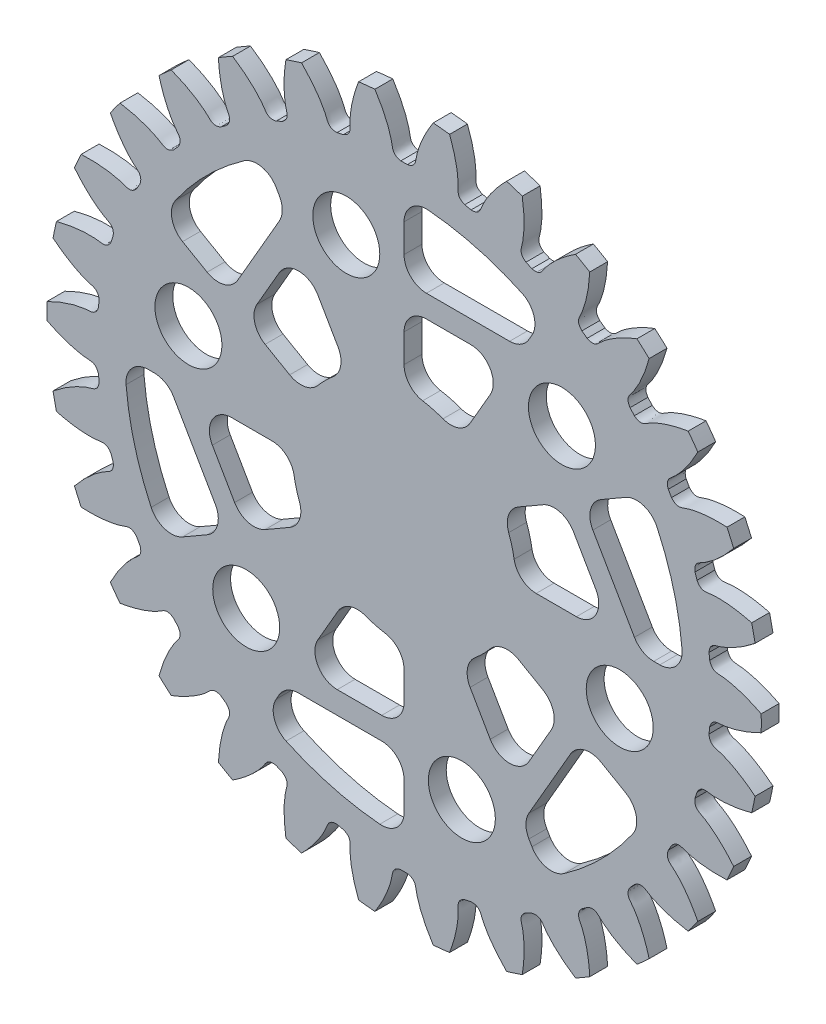
from build123d import *

# Parameters (mm, degrees)
SKETCH_1_R               = 16
EXTRUDE_1_DEPTH          = 30
CUT_EXTRUDE_1_DEPTH      = 38.576588456
PATTERN_CIRCULAR_1_COUNT = 30
SKETCH_4_R               = 28.122827659
CUT_EXTRUDE_2_DEPTH      = 29.2
SKETCH_5_R               = 2.9
EXTRUDE_2_DEPTH          = 1.3
SKETCH_8_R               = 1.4
EXTRUDE_4_DEPTH          = 0.7
SKETCH_9_R               = 1.5
CUT_EXTRUDE_5_DEPTH      = 10
EXTRUDE_5_DEPTH          = 0.8
FILLET_1_R               = 1


with BuildPart() as part:
    # 草图1 → 凸台-拉伸1 (new body)
    with BuildSketch(Plane.XY):
        Circle(SKETCH_1_R)
    extrude(amount=EXTRUDE_1_DEPTH)

    # 草图2 → 切除-拉伸1 (cut, through all)
    with BuildSketch(Plane.XY):
        with BuildLine():
            ThreePointArc((0.145558629, 13.749229531), (0, 13.75), (-0.145558629, 13.749229531))
            add(Edge.make_bspline(
                [(-0.145558629, 13.749229531), (-0.50823069, 13.81297517), (-0.510304747, 14.047132636), (-0.55898482, 14.288579015), (-0.569950741, 14.338129238), (-0.583247086, 14.392924909), (-0.599067717, 14.452897992), (-0.617630624, 14.517964907), (-0.639143358, 14.588038514), (-0.663813512, 14.663024477), (-0.691845294, 14.742822461), (-0.723440342, 14.827325855), (-0.758797267, 14.91642195), (-0.798111576, 15.009991983), (-0.841575482, 15.107911227), (-0.889377751, 15.210049075), (-0.941703547, 15.316269128), (-0.99873427, 15.426429286), (-1.060647407, 15.54038185), (-1.127616379, 15.657973616), (-1.199810393, 15.779045984), (-1.277394296, 15.903435064), (-1.36052843, 16.030971789), (-1.449368495, 16.161482028), (-1.544065407, 16.294786707), (-1.644765164, 16.430701934), (-1.751608718, 16.569039116), (-1.864731839, 16.709605098), (-1.984264996, 16.85220229), (-2.110333232, 16.996628804), (-2.243056043, 17.14267859), (-2.382547265, 17.290141584), (-2.528914958, 17.438803847), (-2.682261311, 17.588447714), (-2.842682483, 17.738851945), (-3.068923866, 17.942620828), (-3.245344618, 18.092071531), (-3.366311832, 18.190558123)],
                knots=[0, 0, 0, 0, 0.115323882, 0.12341257, 0.132512303, 0.142623081, 0.153744905, 0.165877774, 0.179021689, 0.193176649, 0.208342655, 0.224519706, 0.241707802, 0.259906945, 0.279117132, 0.299338365, 0.320570644, 0.342813968, 0.366068337, 0.390333752, 0.415610213, 0.441897719, 0.46919627, 0.497505867, 0.52682651, 0.557158198, 0.588500931, 0.62085471, 0.654219534, 0.688595404, 0.723982319, 0.76038028, 0.797789286, 0.836209338, 0.875640435, 0.916082578, 1, 1, 1, 1], degree=3))
            ThreePointArc((-3.366311832, 18.190558123), (0, 18.499417833), (3.366311832, 18.190558123))
            add(Edge.make_bspline(
                [(0.145558629, 13.749229531), (0.50823069, 13.81297517), (0.510304747, 14.047132636), (0.55898482, 14.288579015), (0.569950741, 14.338129238), (0.583247086, 14.392924909), (0.599067717, 14.452897992), (0.617630624, 14.517964907), (0.639143358, 14.588038514), (0.663813512, 14.663024477), (0.691845294, 14.742822461), (0.723440342, 14.827325855), (0.758797267, 14.91642195), (0.798111576, 15.009991983), (0.841575482, 15.107911227), (0.889377751, 15.210049075), (0.941703547, 15.316269128), (0.99873427, 15.426429286), (1.060647407, 15.54038185), (1.127616379, 15.657973616), (1.199810393, 15.779045984), (1.277394296, 15.903435064), (1.36052843, 16.030971789), (1.449368495, 16.161482028), (1.544065407, 16.294786707), (1.644765164, 16.430701934), (1.751608718, 16.569039116), (1.864731839, 16.709605098), (1.984264996, 16.85220229), (2.110333232, 16.996628804), (2.243056043, 17.14267859), (2.382547265, 17.290141584), (2.528914958, 17.438803847), (2.682261311, 17.588447714), (2.842682483, 17.738851945), (3.068923866, 17.942620828), (3.245344618, 18.092071531), (3.366311832, 18.190558123)],
                knots=[0, 0, 0, 0, 0.115323882, 0.12341257, 0.132512303, 0.142623081, 0.153744905, 0.165877774, 0.179021689, 0.193176649, 0.208342655, 0.224519706, 0.241707802, 0.259906945, 0.279117132, 0.299338365, 0.320570644, 0.342813968, 0.366068337, 0.390333752, 0.415610213, 0.441897719, 0.46919627, 0.497505867, 0.52682651, 0.557158198, 0.588500931, 0.62085471, 0.654219534, 0.688595404, 0.723982319, 0.76038028, 0.797789286, 0.836209338, 0.875640435, 0.916082578, 1, 1, 1, 1], degree=3))
        make_face()
    cut_extrude_1 = extrude(amount=CUT_EXTRUDE_1_DEPTH, mode=Mode.SUBTRACT)

    # 阵列(圆周)1: 切除-拉伸1 ×30 about axis
    pattern_circular_1_axis = Axis((0, 0, -1.5), (0, 0, 1))
    for i in range(1, PATTERN_CIRCULAR_1_COUNT):
        add(cut_extrude_1.rotate(pattern_circular_1_axis, i * 360 / PATTERN_CIRCULAR_1_COUNT), mode=Mode.SUBTRACT)

    # 草图4 → 切除-拉伸2 (cut)
    with BuildSketch(Plane.XY.offset(30)):
        Circle(SKETCH_4_R)
    extrude(amount=-CUT_EXTRUDE_2_DEPTH, mode=Mode.SUBTRACT)

    # 草图5 → 凸台-拉伸2 (add)
    with BuildSketch(Plane.XY):
        Circle(SKETCH_5_R)
    extrude(amount=-EXTRUDE_2_DEPTH)

    # 草图8 → 凸台-拉伸4 (add)
    with BuildSketch(Plane(origin=(0, 0, -1.3), x_dir=(-1, 0, 0), z_dir=(0, 0, -1))):
        Circle(SKETCH_8_R)
    extrude(amount=EXTRUDE_4_DEPTH)

    # 草图9 → 切除-拉伸5 (cut)
    with BuildSketch(Plane(origin=(0, 0, 0), x_dir=(-1, 0, 0), z_dir=(0, 0, -1))):
        with BuildLine():
            ThreePointArc((-2.5, 4.330127019), (-1.294095226, 4.829629131), (0, 5))
            Line((0, 5), (0, 12.5))
            ThreePointArc((0, 12.5), (-3.235238064, 12.074072829), (-6.25, 10.825317547))
            Line((-6.25, 10.825317547), (-2.5, 4.330127019))
        make_face()
        with BuildLine():
            Line((6.25, 10.825317547), (2.5, 4.330127019))
            ThreePointArc((2.5, 4.330127019), (3.535533906, 3.535533906), (4.330127019, 2.5))
            Line((4.330127019, 2.5), (10.825317547, 6.25))
            ThreePointArc((10.825317547, 6.25), (8.838834765, 8.838834765), (6.25, 10.825317547))
        make_face()
        with BuildLine():
            Line((12.5, 0), (5, 0))
            ThreePointArc((5, 0), (4.829629131, -1.294095226), (4.330127019, -2.5))
            Line((4.330127019, -2.5), (10.825317547, -6.25))
            ThreePointArc((10.825317547, -6.25), (12.074072829, -3.235238064), (12.5, 0))
        make_face()
        with BuildLine():
            Line((6.25, -10.825317547), (2.5, -4.330127019))
            ThreePointArc((2.5, -4.330127019), (1.294095226, -4.829629131), (0, -5))
            Line((0, -5), (0, -12.5))
            ThreePointArc((0, -12.5), (3.235238064, -12.074072829), (6.25, -10.825317547))
        make_face()
        with BuildLine():
            Line((-6.25, -10.825317547), (-2.5, -4.330127019))
            ThreePointArc((-2.5, -4.330127019), (-3.535533906, -3.535533906), (-4.330127019, -2.5))
            Line((-4.330127019, -2.5), (-10.825317547, -6.25))
            ThreePointArc((-10.825317547, -6.25), (-8.838834765, -8.838834765), (-6.25, -10.825317547))
        make_face()
        with BuildLine():
            Line((-12.5, 0), (-5, 0))
            ThreePointArc((-5, 0), (-4.829629131, 1.294095226), (-4.330127019, 2.5))
            Line((-4.330127019, 2.5), (-10.825317547, 6.25))
            ThreePointArc((-10.825317547, 6.25), (-12.074072829, 3.235238064), (-12.5, 0))
        make_face()
        with Locations((2.588190451, 9.659258263)):
            Circle(SKETCH_9_R)
        with Locations((9.659258263, 2.588190451)):
            Circle(SKETCH_9_R)
        with Locations((7.071067812, -7.071067812)):
            Circle(SKETCH_9_R)
        with Locations((-2.588190451, -9.659258263)):
            Circle(SKETCH_9_R)
        with Locations((-9.659258263, -2.588190451)):
            Circle(SKETCH_9_R)
        with Locations((-7.071067812, 7.071067812)):
            Circle(SKETCH_9_R)
    extrude(amount=-CUT_EXTRUDE_5_DEPTH, mode=Mode.SUBTRACT)

    # 草图10 → 凸台-拉伸5 (add)
    with BuildSketch(Plane(origin=(0, 0, 0), x_dir=(-1, 0, 0), z_dir=(0, 0, -1))):
        Polygon((0, 9.18625951), (0, 8.18625951), (-4.726339132, 8.18625951), (-5.303689401, 9.18625951), align=None)
        Polygon((-7.955534102, 4.593129755), (-10.607378802, 0), (-9.452678264, 0), (-7.089508698, 4.093129755), align=None)
        Polygon((7.955534102, 4.593129755), (7.089508698, 4.093129755), (4.726339132, 8.18625951), (5.303689401, 9.18625951), align=None)
        Polygon((7.955534102, -4.593129755), (7.089508698, -4.093129755), (9.452678264, 0), (10.607378802, 0), align=None)
        Polygon((0, -9.18625951), (0, -8.18625951), (4.726339132, -8.18625951), (5.303689401, -9.18625951), align=None)
        Polygon((-7.955534102, -4.593129755), (-7.089508698, -4.093129755), (-4.726339132, -8.18625951), (-5.303689401, -9.18625951), align=None)
    extrude(amount=-EXTRUDE_5_DEPTH)

    # 圆角1
    fillet_1_edges = [part.edges().sort_by_distance(p)[0] for p in [
        (4.330127019, 2.5, 0.4),
        (4.330127019, -2.5, 0.4),
        (-2.5, -4.330127019, 0.4),
        (5, 0, 0.4),
        (2.5, -4.330127019, 0.4),
        (-10.825317547, 6.25, 0.4),
        (-12.5, 0, 0.4),
        (-10.825317547, -6.25, 0.4),
        (-6.25, -10.825317547, 0.4),
        (0, -12.5, 0.4),
        (6.25, -10.825317547, 0.4),
        (-4.330127019, -2.5, 0.4),
        (-4.330127019, 2.5, 0.4),
        (-2.5, 4.330127019, 0.4),
        (12.5, 0, 0.4),
        (-6.25, 10.825317547, 0.4),
        (-5, 0, 0.4),
        (0, -5, 0.4),
        (10.825317547, -6.25, 0.4),
        (10.825317547, 6.25, 0.4),
        (0, 5, 0.4),
        (2.5, 4.330127019, 0.4),
        (0, 12.5, 0.4),
        (6.25, 10.825317547, 0.4),
        (-7.089508698, -4.093129755, 0.4),
        (-9.452678264, 0, 0.4),
        (-10.607378802, 0, 0.4),
        (-7.955534102, -4.593129755, 0.4),
        (-5.303689401, -9.18625951, 0.4),
        (0, -8.18625951, 0.4),
        (-4.726339132, -8.18625951, 0.4),
        (0, -9.18625951, 0.4),
        (7.955534102, -4.593129755, 0.4),
        (5.303689401, -9.18625951, 0.4),
        (4.726339132, -8.18625951, 0.4),
        (7.089508698, -4.093129755, 0.4),
        (10.607378802, 0, 0.4),
        (9.452678264, 0, 0.4),
        (7.955534102, 4.593129755, 0.4),
        (7.089508698, 4.093129755, 0.4),
        (5.303689401, 9.18625951, 0.4),
        (0, 8.18625951, 0.4),
        (4.726339132, 8.18625951, 0.4),
        (0, 9.18625951, 0.4),
        (-4.726339132, 8.18625951, 0.4),
        (-7.089508698, 4.093129755, 0.4),
        (-7.955534102, 4.593129755, 0.4),
        (-5.303689401, 9.18625951, 0.4),
    ]]
    fillet(fillet_1_edges, radius=FILLET_1_R)


solid = part.part
